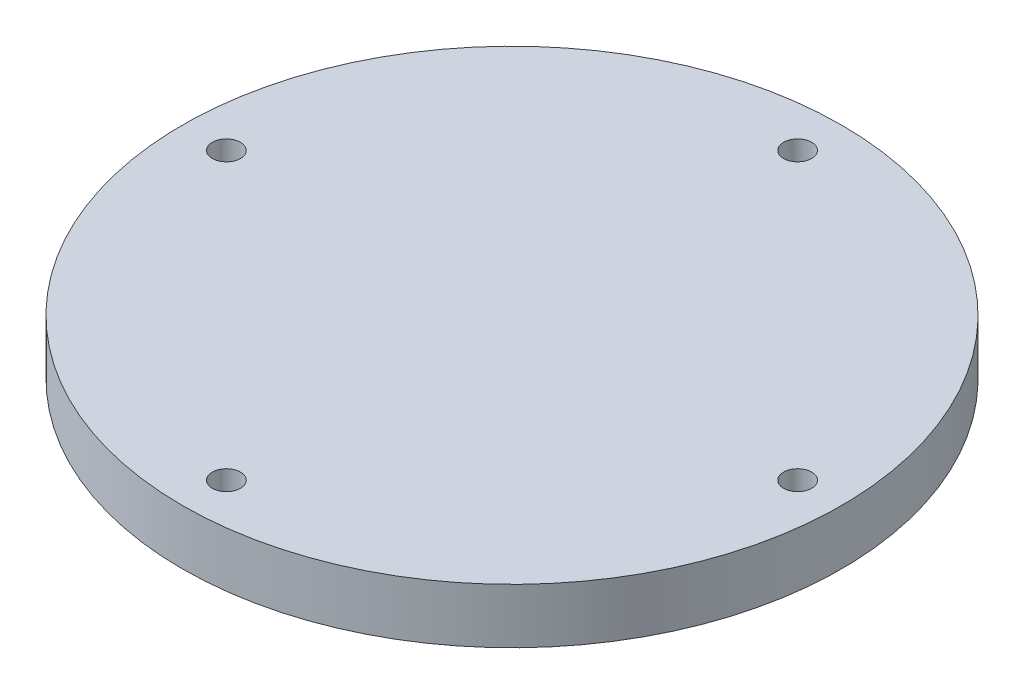
from build123d import *

# Parameters (mm, degrees)
SKETCH1_R           = 38.1
SKETCH1_R_2         = 1.6256
BOSS_EXTRUDE1_DEPTH = 6.35


with BuildPart() as part:
    # Sketch1 → Boss-Extrude1 (new body)
    with BuildSketch(Plane(origin=(0, 0, 0), x_dir=(1, 0, 0), z_dir=(0, 1, 0))):
        Circle(SKETCH1_R)
        with Locations((0, 33.02)):
            Circle(SKETCH1_R_2, mode=Mode.SUBTRACT)
        with Locations((33.02, 0)):
            Circle(SKETCH1_R_2, mode=Mode.SUBTRACT)
        with Locations((0, -33.02)):
            Circle(SKETCH1_R_2, mode=Mode.SUBTRACT)
        with Locations((-33.02, 0)):
            Circle(SKETCH1_R_2, mode=Mode.SUBTRACT)
    extrude(amount=BOSS_EXTRUDE1_DEPTH)


solid = part.part
